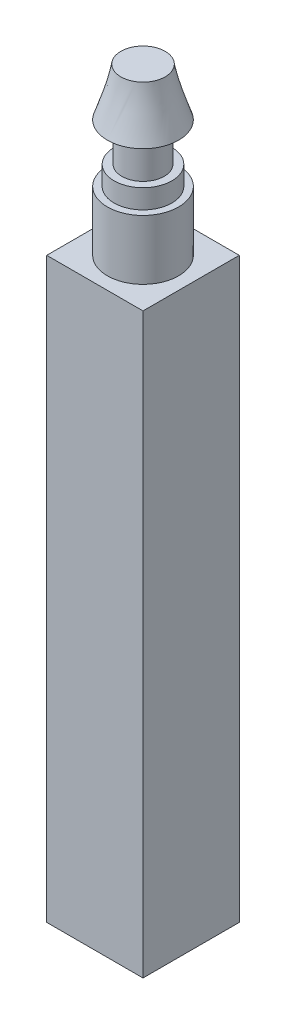
from build123d import *

# Parameters (mm, degrees)
SKETCH1_R           = 1.85
BOSS_EXTRUDE1_DEPTH = 3.1
SKETCH2_R           = 1.5
BOSS_EXTRUDE2_DEPTH = 1
SKETCH3_R           = 1.1
BOSS_EXTRUDE3_DEPTH = 2
SKETCH6_W           = 5
SKETCH6_H           = 5
BOSS_EXTRUDE4_DEPTH = 30
SKETCH7_R           = 1
CUT_EXTRUDE1_DEPTH  = 24


with BuildPart() as part:
    # Sketch1 → Boss-Extrude1 (new body)
    with BuildSketch(Plane(origin=(0, 0, 0), x_dir=(1, 0, 0), z_dir=(0, 1, 0))):
        with Locations(Location((0, 0, 0), (0, 0, 90))):
            Circle(SKETCH1_R)
    extrude(amount=BOSS_EXTRUDE1_DEPTH)

    # Sketch2 → Boss-Extrude2 (add)
    with BuildSketch(Plane(origin=(0, 3.1, 0), x_dir=(1, 0, 0), z_dir=(0, 1, 0))):
        with Locations(Location((0, 0, 0), (0, 0, 270))):
            Circle(SKETCH2_R)
    extrude(amount=BOSS_EXTRUDE2_DEPTH)

    # Sketch3 → Boss-Extrude3 (add)
    with BuildSketch(Plane(origin=(0, 4.1, 0), x_dir=(1, 0, 0), z_dir=(0, 1, 0))):
        with Locations(Location((0, 0, 0), (0, 0, 270))):
            Circle(SKETCH3_R)
    extrude(amount=BOSS_EXTRUDE3_DEPTH)

    # Loft1: read off the stored shape, not the designer's step
    # Loft1: loft between two sections, ruled curve by curve
    loft1_from = [
        Edge.make_bspline([(0, 6.1, 1.85), (3.7, 6.1, 1.85), (3.7, 6.1, -1.85), (0, 6.1, -1.85), (-3.7, 6.1, -1.85), (-3.7, 6.1, 1.85), (0, 6.1, 1.85)], [0, 0, 0, 0, 0.5, 0.5, 0.5, 1, 1, 1, 1], 3, [1, 0.333333333, 0.333333333, 1, 0.333333333, 0.333333333, 1]),
    ]
    loft1_to = [
        Edge.make_bspline([(0.620465421, 8.6, 0.968257539), (2.556980499, 8.6, -0.272673303), (1.316049657, 8.6, -2.209188381), (-0.620465421, 8.6, -0.968257539), (-2.556980499, 8.6, 0.272673303), (-1.316049657, 8.6, 2.209188381), (0.620465421, 8.6, 0.968257539)], [0, 0, 0, 0, 0.5, 0.5, 0.5, 1, 1, 1, 1], 3, [1, 0.333333333, 0.333333333, 1, 0.333333333, 0.333333333, 1]),
    ]
    loft1 = Solid(Shell([*[Face.make_surface_from_curves(loft1_from[k], loft1_to[k]) for k in range(1)], Face(Wire(loft1_from)), Face(Wire(loft1_to))]))
    add(loft1)

    # Sketch6 → Boss-Extrude4 (add)
    with BuildSketch(Plane.XZ):
        Rectangle(SKETCH6_W, SKETCH6_H)
    extrude(amount=BOSS_EXTRUDE4_DEPTH)

    # Sketch7 → Cut-Extrude1 (cut)
    with BuildSketch(Plane.XZ.offset(30)):
        with Locations(Location((0, 0, 0), (0, 0, 270))):
            Circle(SKETCH7_R)
    extrude(amount=-CUT_EXTRUDE1_DEPTH, mode=Mode.SUBTRACT)


solid = part.part
